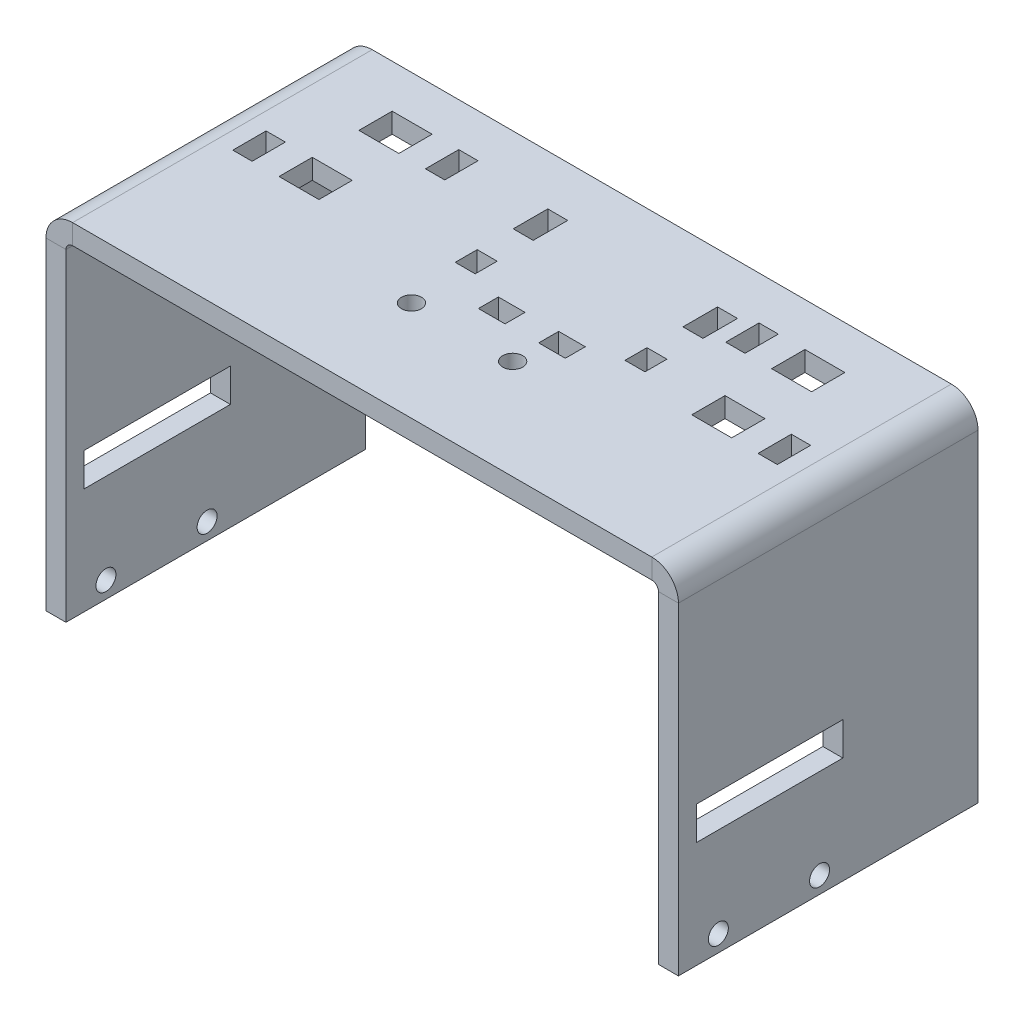
from build123d import *

# Parameters (mm, degrees)
SKETCH1_R                  = 1.5
SKETCH1_W                  = 2.9
SKETCH1_H                  = 5
SKETCH1_W_2                = 6
SKETCH1_W_3                = 5
SKETCH1_H_2                = 22
BASE_FLANGE1_DEPTH         = 3
SKETCH34_W                 = 3
SKETCH34_H                 = 5.190452684
SKETCH34_H_2               = 3.298760194
CUT_EXTRUDE2_DEPTH         = 10
SKETCH35_W                 = 4
SKETCH35_H                 = 3
CUT_EXTRUDE3_DEPTH         = 10
SKETCHED_START             = -31.946571622
SKETCHED_BEND1_DEPTH       = 45
SKETCHED_BEND1_2_OUTLINE_W = 3
SKETCHED_BEND1_2_OUTLINE_H = 16
SKETCHED_BEND1_2_DEPTH     = 45
SKETCHED_BEND1_3_OUTLINE_W = 3
SKETCHED_BEND1_3_OUTLINE_H = 5
SKETCHED_BEND1_3_DEPTH     = 20.3
SKETCHED_START_2           = 10.353428378
SKETCHED_BEND1_4_OUTLINE_W = 3
SKETCHED_BEND1_4_OUTLINE_H = 5
SKETCHED_BEND1_4_DEPTH     = 2.7
SKETCHED_START_3           = -48
SKETCHED_BEND1_5_OUTLINE_R = 1.5
SKETCHED_BEND1_5_DEPTH     = 96


with BuildPart() as part:
    # Base-Flange1: sheet metal written as solids
    # Sketch1 → Base-Flange1 (new body)
    with BuildSketch(Plane(origin=(0, 0, 0), x_dir=(1, 0, 0), z_dir=(0, 1, 0))):
        Polygon((-95, 31.946571622), (-95, -13.053428378), (95, -13.053428378), (95, 31.946571622), (45, 31.946571622), (-45, 31.946571622), align=None)
        with Locations(Location((92.5, -7.053428378, 0), (0, 0, 270))):
            Circle(SKETCH1_R, mode=Mode.SUBTRACT)
        with Locations(Location((92.5, 8.146571622, 0), (0, 0, 270))):
            Circle(SKETCH1_R, mode=Mode.SUBTRACT)
        with Locations(Location((-92.5, -7.053428378, 0), (0, 0, 90))):
            Circle(SKETCH1_R, mode=Mode.SUBTRACT)
        with Locations(Location((-92.5, 8.146571622, 0), (0, 0, 90))):
            Circle(SKETCH1_R, mode=Mode.SUBTRACT)
        with Locations(Location((7.6, 1.946571622, 0), (0, 0, 270))):
            Circle(SKETCH1_R, mode=Mode.SUBTRACT)
        with Locations(Location((-7.6, 1.946571622, 0), (0, 0, 270))):
            Circle(SKETCH1_R, mode=Mode.SUBTRACT)
        with Locations((-39.45, 10.905641405)):
            Rectangle(SKETCH1_W, SKETCH1_H, mode=Mode.SUBTRACT)
        with Locations((-22.55, 22.947848405)):
            Rectangle(SKETCH1_W, SKETCH1_H, mode=Mode.SUBTRACT)
        with Locations((-31, 22.946571622)):
            Rectangle(SKETCH1_W_2, SKETCH1_H, mode=Mode.SUBTRACT)
        with Locations((-31, 10.946571622)):
            Rectangle(SKETCH1_W_2, SKETCH1_H, mode=Mode.SUBTRACT)
        with Locations((31, 10.946571622)):
            Rectangle(SKETCH1_W_2, SKETCH1_H, mode=Mode.SUBTRACT)
        with Locations((31, 22.946571622)):
            Rectangle(SKETCH1_W_2, SKETCH1_H, mode=Mode.SUBTRACT)
        with Locations((22.55, 22.947848405)):
            Rectangle(SKETCH1_W, SKETCH1_H, mode=Mode.SUBTRACT)
        with Locations((39.45, 10.905641405)):
            Rectangle(SKETCH1_W, SKETCH1_H, mode=Mode.SUBTRACT)
        with Locations((76.5, 0.646571622)):
            Rectangle(SKETCH1_W_3, SKETCH1_H_2, mode=Mode.SUBTRACT)
        with Locations((-76.5, 0.646571622)):
            Rectangle(SKETCH1_W_3, SKETCH1_H_2, mode=Mode.SUBTRACT)
    extrude(amount=-BASE_FLANGE1_DEPTH)

    # Sketch34 → Cut-Extrude2 (cut)
    with BuildSketch(Plane.XZ.offset(3)):
        with Locations((17.4, -21.824895141)):
            Rectangle(SKETCH34_W, SKETCH34_H)
        with Locations((-8.1, -21.824895141)):
            Rectangle(SKETCH34_W, SKETCH34_H)
        with Locations((-8.1, -12.169238167)):
            Rectangle(SKETCH34_W, SKETCH34_H_2)
        with Locations((17.4, -12.169238167)):
            Rectangle(SKETCH34_W, SKETCH34_H_2)
    extrude(amount=-CUT_EXTRUDE2_DEPTH, mode=Mode.SUBTRACT)

    # Sketch35 → Cut-Extrude3 (cut)
    with BuildSketch(Plane(origin=(0, 0, 0), x_dir=(1, 0, 0), z_dir=(0, 1, 0))):
        with Locations((0.15, 7.74985807)):
            Rectangle(SKETCH35_W, SKETCH35_H)
        with Locations((9.15, 7.806187778)):
            Rectangle(SKETCH35_W, SKETCH35_H)
    extrude(amount=-CUT_EXTRUDE3_DEPTH, mode=Mode.SUBTRACT)

    # Sketched Bend1: read off the stored shape, not the designer's step
    # Sketched Bend1 outline → Sketched Bend1 (cut)
    with BuildSketch(Plane.XY.offset(SKETCHED_START)):
        with BuildLine():
            ThreePointArc((43.5, 0), (45.949489743, -0.83772234), (47.372983346, -3))
            Line((47.372983346, -3), (95, -3))
            Line((95, -3), (95, 0))
            Line((95, 0), (43.5, 0))
        make_face()
        with BuildLine():
            ThreePointArc((-47.372983346, -3), (-45.949489743, -0.83772234), (-43.5, 0))
            Line((-43.5, 0), (-95, 0))
            Line((-95, 0), (-95, -3))
            Line((-95, -3), (-47.372983346, -3))
        make_face()
    extrude(amount=SKETCHED_BEND1_DEPTH, mode=Mode.SUBTRACT)

    # Sketched Bend1 2 outline → Sketched Bend1 2 (add)
    with BuildSketch(Plane.XY.offset(SKETCHED_START)):
        with BuildLine():
            ThreePointArc((43.5, -3), (44.207106781, -3.292893219), (44.5, -4))
            Line((44.5, -4), (44.5, -31.5))
            Line((44.5, -31.5), (47.5, -31.5))
            Line((47.5, -31.5), (47.5, -4))
            ThreePointArc((47.5, -4), (47.468118785, -3.49598283), (47.372983346, -3))
            Line((47.372983346, -3), (43.5, -3))
        make_face()
        with BuildLine():
            ThreePointArc((-44.5, -4), (-44.207106781, -3.292893219), (-43.5, -3))
            Line((-43.5, -3), (-47.372983346, -3))
            ThreePointArc((-47.372983346, -3), (-47.468118785, -3.49598283), (-47.5, -4))
            Line((-47.5, -4), (-47.5, -31.5))
            Line((-47.5, -31.5), (-44.5, -31.5))
            Line((-44.5, -31.5), (-44.5, -4))
        make_face()
        with Locations((46, -44.5)):
            Rectangle(SKETCHED_BEND1_2_OUTLINE_W, SKETCHED_BEND1_2_OUTLINE_H)
        with Locations((-46, -44.5)):
            Rectangle(SKETCHED_BEND1_2_OUTLINE_W, SKETCHED_BEND1_2_OUTLINE_H)
    extrude(amount=SKETCHED_BEND1_2_DEPTH)

    # Sketched Bend1 3 outline → Sketched Bend1 3 (add)
    with BuildSketch(Plane.XY.offset(SKETCHED_START)):
        with Locations((46, -34)):
            Rectangle(SKETCHED_BEND1_3_OUTLINE_W, SKETCHED_BEND1_3_OUTLINE_H)
        with Locations((-46, -34)):
            Rectangle(SKETCHED_BEND1_3_OUTLINE_W, SKETCHED_BEND1_3_OUTLINE_H)
    extrude(amount=SKETCHED_BEND1_3_DEPTH)

    # Sketched Bend1 4 outline → Sketched Bend1 4 (add)
    with BuildSketch(Plane.XY.offset(SKETCHED_START_2)):
        with Locations((46, -34)):
            Rectangle(SKETCHED_BEND1_4_OUTLINE_W, SKETCHED_BEND1_4_OUTLINE_H)
        with Locations((-46, -34)):
            Rectangle(SKETCHED_BEND1_4_OUTLINE_W, SKETCHED_BEND1_4_OUTLINE_H)
    extrude(amount=SKETCHED_BEND1_4_DEPTH)

    # Sketched Bend1 5 outline → Sketched Bend1 5 (cut)
    with BuildSketch(Plane.YZ.offset(SKETCHED_START_3)):
        with Locations((-50, -8.146571622)):
            Circle(SKETCHED_BEND1_5_OUTLINE_R)
        with Locations((-50, 7.053428378)):
            Circle(SKETCHED_BEND1_5_OUTLINE_R)
    extrude(amount=SKETCHED_BEND1_5_DEPTH, mode=Mode.SUBTRACT)


solid = part.part
